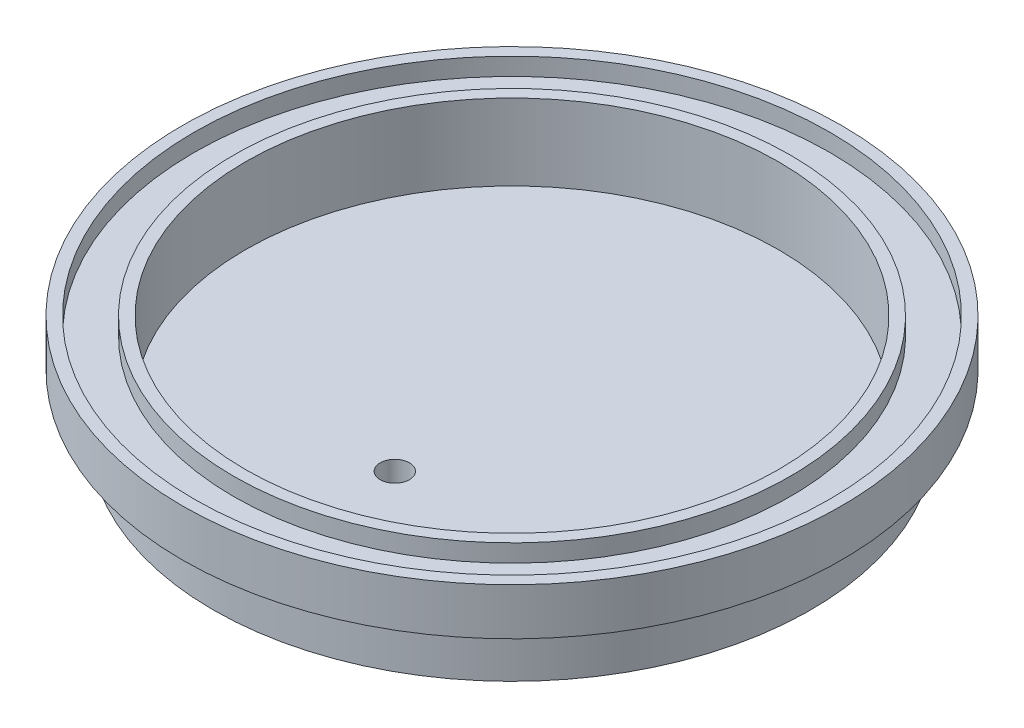
from build123d import *

# Parameters (mm, degrees)
SKETCH1_R             = 56.25
SKETCH1_R_2           = 54.25
BOSS_EXTRUDE1_DEPTH   = 3
SKETCH1_R_3           = 47.5
SKETCH1_R_4           = 45.5
BOSS_EXTRUDE1_2_DEPTH = 3
SKETCH1_3_R           = 51
BOSS_EXTRUDE2_DEPTH   = 15
BOSS_EXTRUDE3_START   = -5
SKETCH1_4_R           = 56.25
BOSS_EXTRUDE3_DEPTH   = 5
BOSS_EXTRUDE4_DEPTH   = 5
CUT_EXTRUDE1_START    = -10
SKETCH1_5_R           = 45.5
CUT_EXTRUDE1_DEPTH    = 10
SKETCH3_R             = 2.5
CUT_EXTRUDE2_DEPTH    = 81.604745518


with BuildPart() as part:
    # Sketch1 → Boss-Extrude1 (new body)
    with BuildSketch(Plane(origin=(0, 0, 0), x_dir=(1, 0, 0), z_dir=(0, 1, 0))):
        Circle(SKETCH1_R)
        Circle(SKETCH1_R_2, mode=Mode.SUBTRACT)
    extrude(amount=BOSS_EXTRUDE1_DEPTH)



with BuildPart() as body_2:
    # Sketch1 → Boss-Extrude1 2 (new body)
    with BuildSketch(Plane(origin=(0, 0, 0), x_dir=(1, 0, 0), z_dir=(0, 1, 0))):
        Circle(SKETCH1_R_3)
        Circle(SKETCH1_R_4, mode=Mode.SUBTRACT)
    extrude(amount=BOSS_EXTRUDE1_2_DEPTH)


with BuildPart() as body_3:
    # Sketch1<3> → Boss-Extrude2 (new body)
    with BuildSketch(Plane(origin=(0, 0, 0), x_dir=(1, 0, 0), z_dir=(0, 1, 0))):
        Circle(SKETCH1_3_R)
    extrude(amount=-BOSS_EXTRUDE2_DEPTH)


with BuildPart() as part_1:
    add(part.part)

    add(body_2.part)  # Boss-Extrude3 merges body 2

    add(body_3.part)  # Boss-Extrude3 merges body 3
    # Sketch1<4> → Boss-Extrude3 (add)
    with BuildSketch(Plane(origin=(0, 0, 0), x_dir=(1, 0, 0), z_dir=(0, 1, 0)).offset(BOSS_EXTRUDE3_START)):
        Circle(SKETCH1_4_R)
    extrude(amount=BOSS_EXTRUDE3_DEPTH)

    # Sketch2 → Boss-Extrude4 (add)
    with BuildSketch(Plane.XZ.offset(5)):
        Polygon((-2.35, -51), (-2.35, -56), (2.35, -56), (2.35, -51), (2.35, -50), (-2.35, -50), align=None)
    extrude(amount=BOSS_EXTRUDE4_DEPTH)

    # Sketch1<5> → Cut-Extrude1 (cut)
    with BuildSketch(Plane(origin=(0, 0, 0), x_dir=(1, 0, 0), z_dir=(0, 1, 0)).offset(CUT_EXTRUDE1_START)):
        Circle(SKETCH1_5_R)
    extrude(amount=CUT_EXTRUDE1_DEPTH, mode=Mode.SUBTRACT)

    # Sketch3 → Cut-Extrude2 (cut, through all)
    with BuildSketch(Plane(origin=(0, -10, 0), x_dir=(1, 0, 0), z_dir=(0, 1, 0))):
        with Locations((0, -20)):
            Circle(SKETCH3_R)
    extrude(amount=-CUT_EXTRUDE2_DEPTH, mode=Mode.SUBTRACT)


solid = part_1.part
